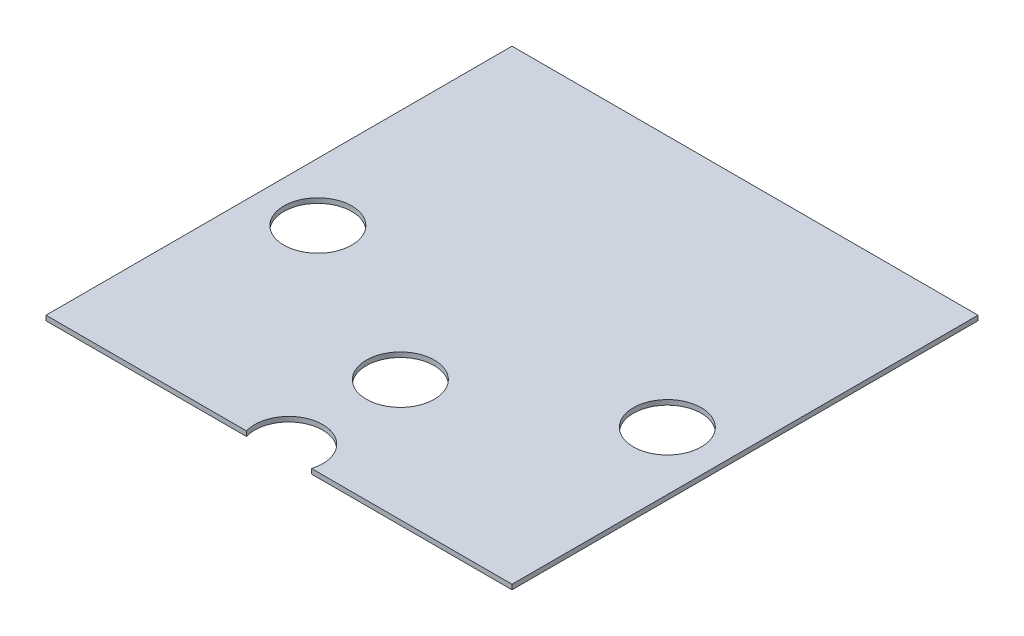
from build123d import *

# Parameters (mm, degrees)
SKETCH1_W           = 609.6
SKETCH1_H           = 609.6
BOSS_EXTRUDE1_DEPTH = 6.35
SKETCH2_R           = 44.45
CUT_EXTRUDE1_DEPTH  = 101.6


with BuildPart() as part:
    # Sketch1 → Boss-Extrude1 (new body)
    with BuildSketch(Plane(origin=(0, 0, 0), x_dir=(1, 0, 0), z_dir=(0, 1, 0))):
        with Locations((-82.357575758, -23.090909091)):
            Rectangle(SKETCH1_W, SKETCH1_H)
    extrude(amount=BOSS_EXTRUDE1_DEPTH)

    # Sketch2 → Cut-Extrude1 (cut)
    with BuildSketch(Plane(origin=(0, 6.35, 0), x_dir=(1, 0, 0), z_dir=(0, 1, 0))):
        with Locations((-82.357575758, -315.190909091)):
            Circle(SKETCH2_R)
        with Locations((-82.357575758, -169.140909091)):
            Circle(SKETCH2_R)
        with Locations((-310.957575758, -48.490909091)):
            Circle(SKETCH2_R)
        with Locations((146.242424242, -48.490909091)):
            Circle(SKETCH2_R)
    extrude(amount=-CUT_EXTRUDE1_DEPTH, mode=Mode.SUBTRACT)


solid = part.part
